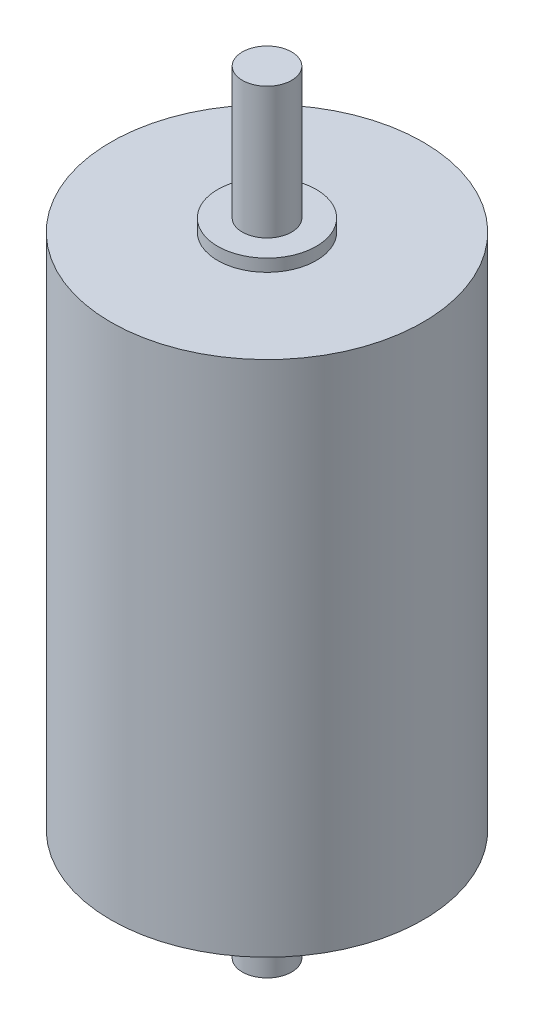
from build123d import *


with BuildPart() as part:
    # Esquisse1 → Révolution1 (revolve)
    with BuildSketch(Plane.XY):
        Polygon((0, 0), (0, 94), (3, 94), (3, 78), (6, 78), (6, 76.5), (19, 76.5), (19, 13.5), (6, 13.5), (6, 12), (3, 12), (3, 0), align=None)
    revolve(axis=Axis((0, 0, 0), (0, 1, 0)))


solid = part.part
